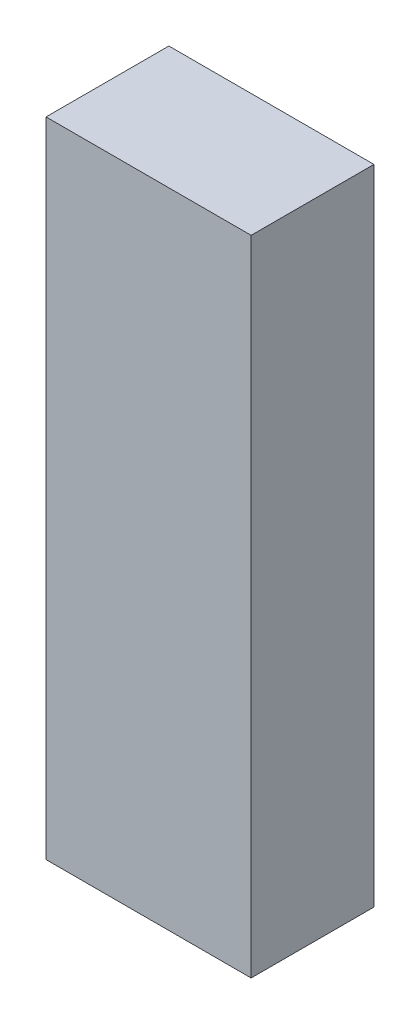
from build123d import *

# Parameters (mm, degrees)
SKETCH1_W           = 40.493891915
SKETCH1_H           = 24.251425102
BOSS_EXTRUDE1_DEPTH = 127
SKETCH2_W           = 27.939981872
SKETCH2_H           = 112.403705874
CUT_EXTRUDE1_DEPTH  = 16.764


with BuildPart() as part:
    # Sketch1 → Boss-Extrude1 (new body)
    with BuildSketch(Plane(origin=(0, 0, 0), x_dir=(1, 0, 0), z_dir=(0, 1, 0))):
        with Locations((20.246945958, 12.125712551)):
            Rectangle(SKETCH1_W, SKETCH1_H)
    extrude(amount=BOSS_EXTRUDE1_DEPTH)

    # Sketch2 → Cut-Extrude1 (cut)
    with BuildSketch(Plane(origin=(0, 0, -24.251425102), x_dir=(-1, 0, 0), z_dir=(0, 0, -1))):
        with Locations((-19.73192325, 62.756716094)):
            Rectangle(SKETCH2_W, SKETCH2_H)
    extrude(amount=-CUT_EXTRUDE1_DEPTH, mode=Mode.SUBTRACT)


solid = part.part
